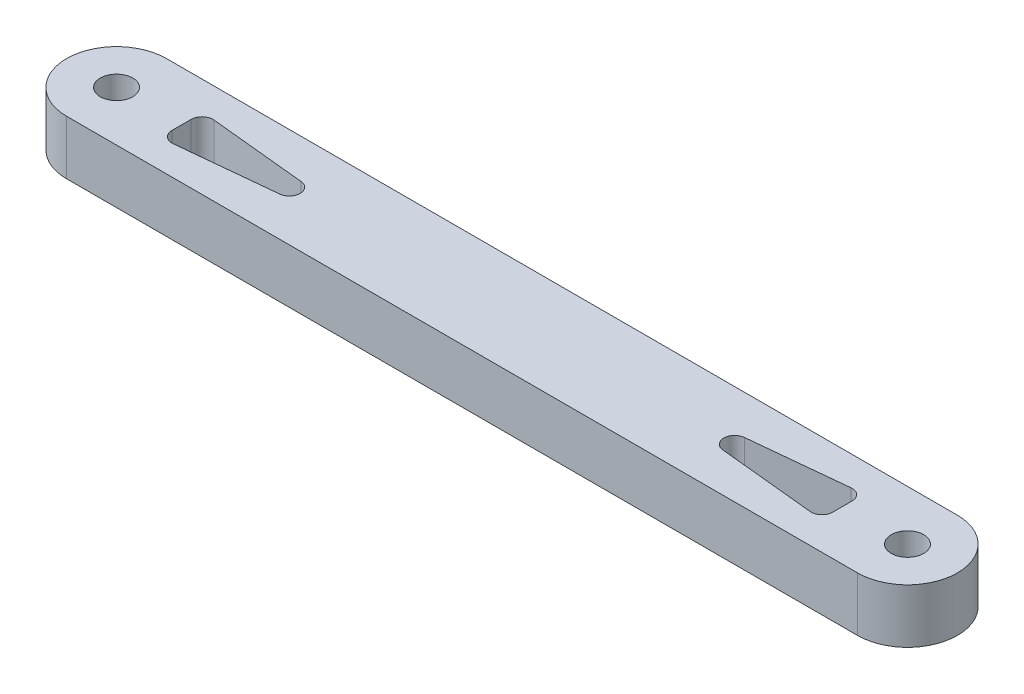
from build123d import *

# Parameters (mm, degrees)
SKETCH1_R           = 1.5
BOSS_EXTRUDE1_DEPTH = 5
CUT_EXTRUDE2_DEPTH  = 17
FILLET1_R           = 1


with BuildPart() as part:
    # Sketch1 → Boss-Extrude1 (new body)
    with BuildSketch(Plane(origin=(0, 0, 0), x_dir=(1, 0, 0), z_dir=(0, 1, 0))):
        with BuildLine():
            Line((73, 4.610590887), (0, 4.610590887))
            ThreePointArc((0, 4.610590887), (-4.610590887, 0), (0, -4.610590887))
            Line((0, -4.610590887), (73, -4.610590887))
            ThreePointArc((73, -4.610590887), (77.610590887, 0), (73, 4.610590887))
        make_face()
        Circle(SKETCH1_R, mode=Mode.SUBTRACT)
        with Locations((73, 0)):
            Circle(SKETCH1_R, mode=Mode.SUBTRACT)
    extrude(amount=BOSS_EXTRUDE1_DEPTH)

    # Sketch3 → Cut-Extrude2 (cut)
    with BuildSketch(Plane(origin=(0, 5, 0), x_dir=(1, 0, 0), z_dir=(0, 1, 0))):
        Polygon((6, 2), (6, -2), (26, 0), align=None)
        Polygon((67, 2), (67, -2), (47, 0), align=None)
    extrude(amount=-CUT_EXTRUDE2_DEPTH, mode=Mode.SUBTRACT)

    # Fillet1
    fillet1_edges = [part.edges().sort_by_distance(p)[0] for p in [
        (67, 2.5, 2),
        (67, 2.5, -2),
        (47, 2.5, 0),
        (26, 2.5, 0),
        (6, 2.5, 2),
        (6, 2.5, -2),
    ]]
    fillet(fillet1_edges, radius=FILLET1_R)


solid = part.part
